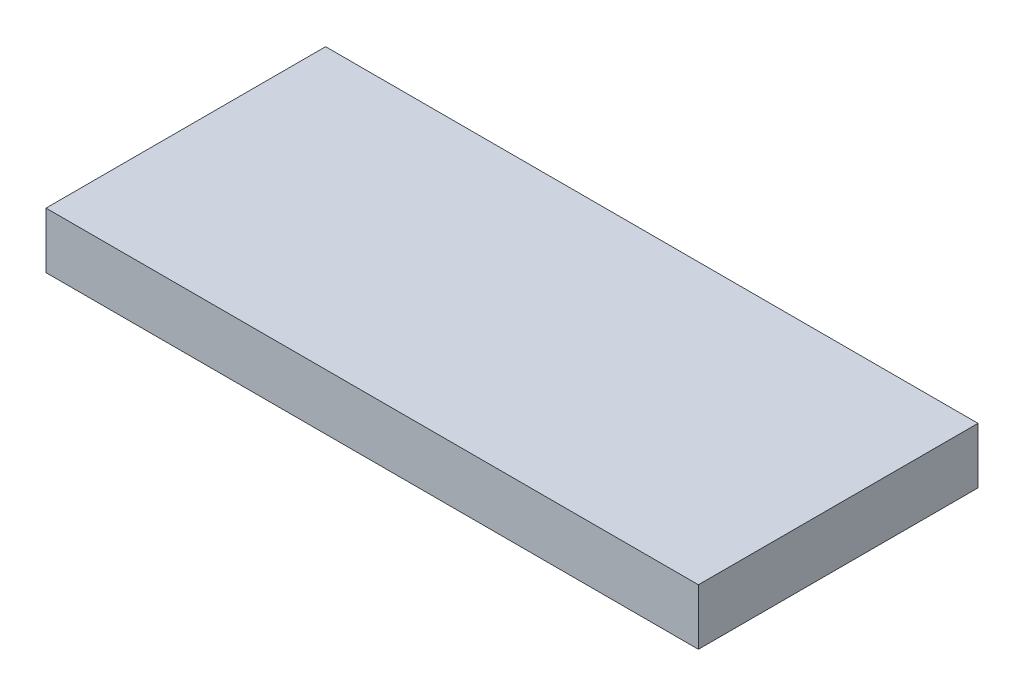
from build123d import *

# Parameters (mm, degrees)
SKETCH1_W           = 35
SKETCH1_H           = 15
BOSS_EXTRUDE1_DEPTH = 3


with BuildPart() as part:
    # Sketch1 → Boss-Extrude1 (new body)
    with BuildSketch(Plane(origin=(0, 0, 0), x_dir=(1, 0, 0), z_dir=(0, 1, 0))):
        with Locations((17.5, 7.5)):
            Rectangle(SKETCH1_W, SKETCH1_H)
    extrude(amount=BOSS_EXTRUDE1_DEPTH)


solid = part.part
